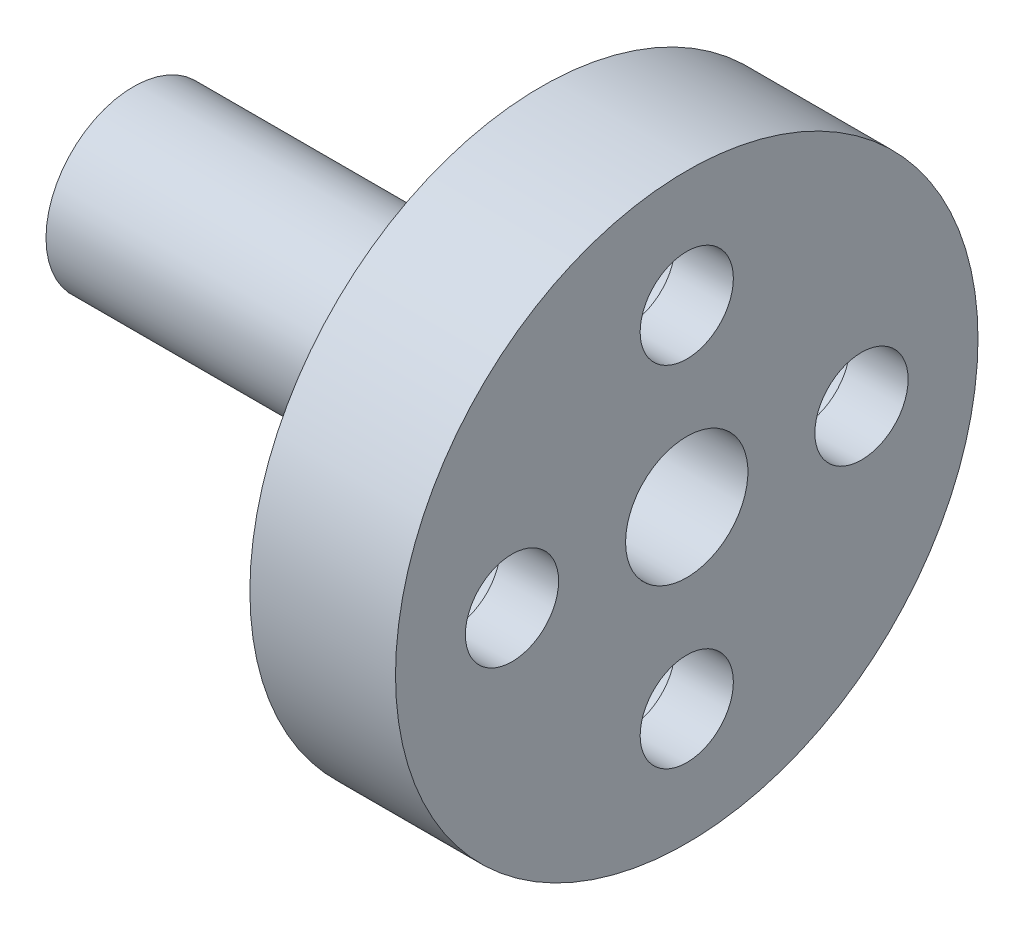
from build123d import *

# Parameters (mm, degrees)
CUT_EXTRUDE1_DEPTH      = 24.685438565
CUT_EXTRUDE1_DEPTH_BACK = 24.685438565
SKETCH2_R               = 1.6
SKETCH3_R               = 2.85
CUT_EXTRUDE2_DEPTH      = 3


with BuildPart() as part:
    # Sketch1 → Revolve1 (revolve)
    with BuildSketch(Plane.XY):
        Polygon((0, 2.1), (0, 10), (-5, 10), (-5, 3), (-19, 3), (-19, 0), (-13, 0), (-13, 2.1), align=None)
    revolve(axis=Axis((-10, 0, 0), (1, 0, 0)))

    # Sketch2 → Cut-Extrude1 (cut, two sides: drawn at the far end of the back side and taken through both)
    with BuildSketch(Plane(origin=(0, 0, 0), x_dir=(0, 0, -1), z_dir=(1, 0, 0)).offset(-CUT_EXTRUDE1_DEPTH_BACK)):
        with Locations((-6, 0)):
            Circle(SKETCH2_R)
        with Locations((6, 0)):
            Circle(SKETCH2_R)
        with Locations((0, 6)):
            Circle(SKETCH2_R)
        with Locations((0, -6)):
            Circle(SKETCH2_R)
    extrude(amount=CUT_EXTRUDE1_DEPTH + CUT_EXTRUDE1_DEPTH_BACK, mode=Mode.SUBTRACT)

    # Sketch3 → Cut-Extrude2 (cut)
    with BuildSketch(Plane(origin=(-5, 0, 0), x_dir=(0, 0, -1), z_dir=(1, 0, 0))):
        with Locations((-6, 0)):
            Circle(SKETCH3_R)
        with Locations((6, 0)):
            Circle(SKETCH3_R)
        with Locations((0, 6)):
            Circle(SKETCH3_R)
        with Locations((0, -6)):
            Circle(SKETCH3_R)
    extrude(amount=CUT_EXTRUDE2_DEPTH, mode=Mode.SUBTRACT)


solid = part.part
